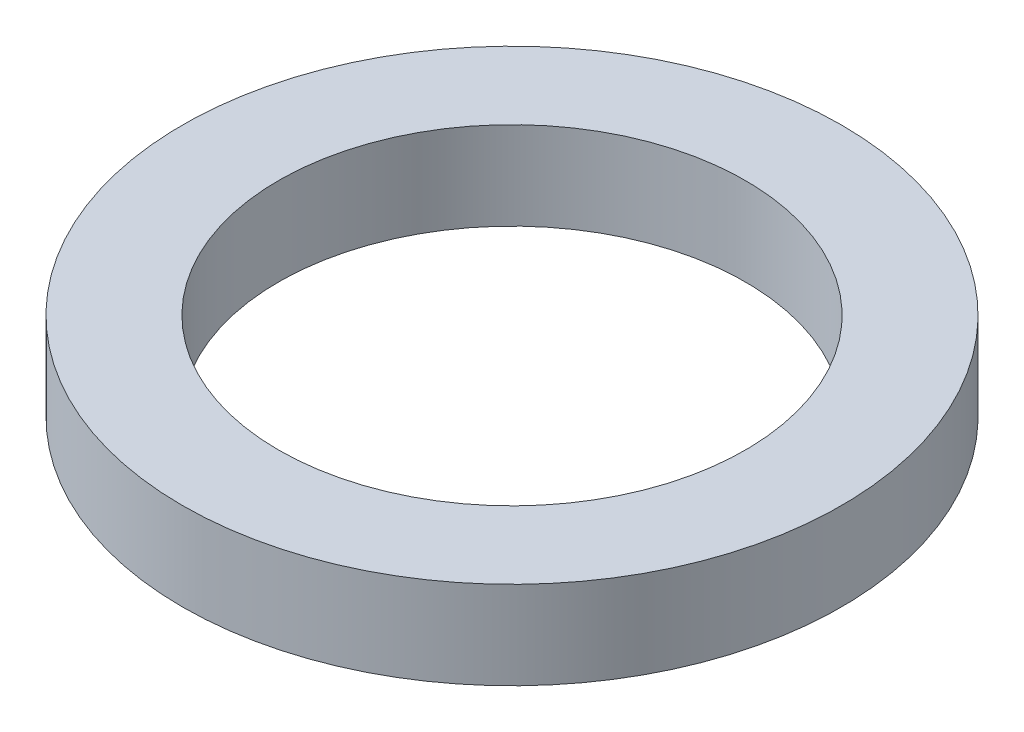
from build123d import *

# Parameters (mm, degrees)
SKETCH1_R           = 60
BOSS_EXTRUDE1_DEPTH = 16
SKETCH2_R           = 42.5
CUT_EXTRUDE1_DEPTH  = 87.34813258


with BuildPart() as part:
    # Sketch1 → Boss-Extrude1 (new body)
    with BuildSketch(Plane(origin=(0, 0, 0), x_dir=(1, 0, 0), z_dir=(0, 1, 0))):
        Circle(SKETCH1_R)
    extrude(amount=BOSS_EXTRUDE1_DEPTH)

    # Sketch2 → Cut-Extrude1 (cut, through all)
    with BuildSketch(Plane(origin=(0, 0, 0), x_dir=(1, 0, 0), z_dir=(0, 1, 0))):
        Circle(SKETCH2_R)
    extrude(amount=CUT_EXTRUDE1_DEPTH, mode=Mode.SUBTRACT)


solid = part.part
